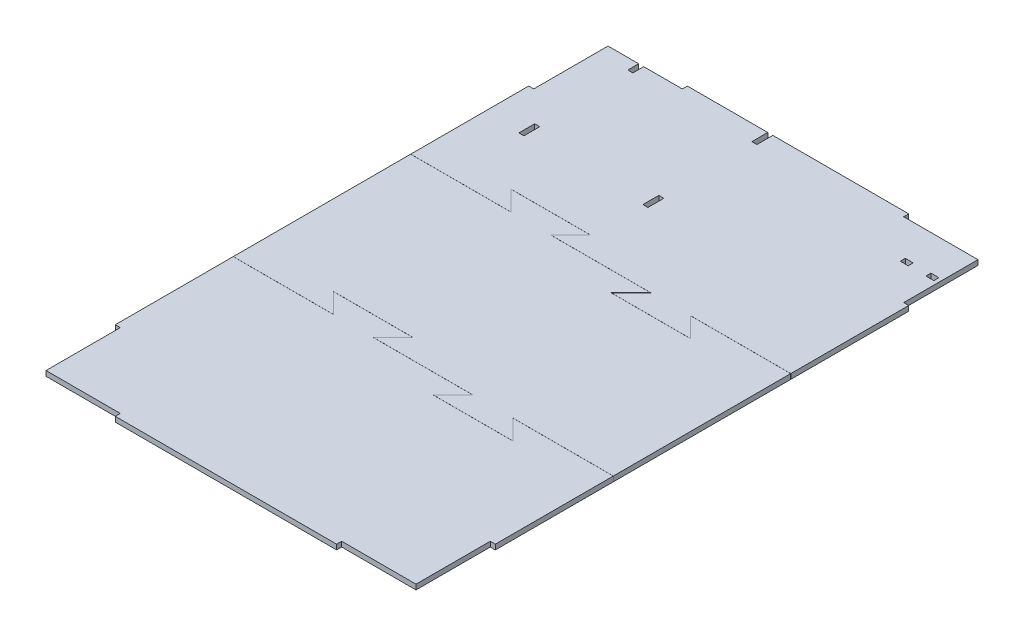
from build123d import *

# Parameters (mm, degrees)
SKETCH1_W           = 479
SKETCH1_H           = 721
BOSS_EXTRUDE1_DEPTH = 3.175
CUT_EXTRUDE1_DEPTH  = 433.851963724
SKETCH3_W           = 6.35
SKETCH3_H           = 20
SKETCH3_W_2         = 10
SKETCH3_H_2         = 6.35
CUT_EXTRUDE2_DEPTH  = 433.851963724
CUT_EXTRUDE3_DEPTH  = 433.851963724


with BuildPart() as part:
    # Sketch1 → Boss-Extrude1 (new, symmetric)
    with BuildSketch(Plane(origin=(0, 0, 0), x_dir=(1, 0, 0), z_dir=(0, 1, 0))):
        Rectangle(SKETCH1_W, SKETCH1_H)
    extrude(amount=BOSS_EXTRUDE1_DEPTH, both=True)

    # Sketch2 → Cut-Extrude1 (cut, through all)
    with BuildSketch(Plane(origin=(0, 3.175, 0), x_dir=(1, 0, 0), z_dir=(0, 1, 0))):
        Polygon((-239.5, 360.5), (-239.5, 260.5), (-233.15, 260.5), (-233.15, 354.15), (-139.5, 354.15), (-139.5, 360.5), align=None)
        Polygon((239.5, 360.5), (139.5, 360.5), (139.5, 354.15), (233.15, 354.15), (233.15, 260.5), (239.5, 260.5), align=None)
        Polygon((239.5, -360.5), (239.5, -260.5), (233.15, -260.5), (233.15, -354.15), (139.5, -354.15), (139.5, -360.5), align=None)
        Polygon((-239.5, -360.5), (-139.5, -360.5), (-139.5, -354.15), (-233.15, -354.15), (-233.15, -260.5), (-239.5, -260.5), align=None)
    extrude(amount=-CUT_EXTRUDE1_DEPTH, mode=Mode.SUBTRACT)

    # Sketch3 → Cut-Extrude2 (cut, through all)
    with BuildSketch(Plane.XZ.offset(3.175)):
        with Locations((-34.975, -350.5)):
            Rectangle(SKETCH3_W, SKETCH3_H)
        with Locations((190.85, -306.625)):
            Rectangle(SKETCH3_W_2, SKETCH3_H_2)
        with Locations((223.15, -306.625)):
            Rectangle(SKETCH3_W_2, SKETCH3_H_2)
        with Locations((-191.325, -350.5)):
            Rectangle(SKETCH3_W, SKETCH3_H)
        with Locations((-34.975, -213.15)):
            Rectangle(SKETCH3_W, SKETCH3_H)
        with Locations((-191.325, -213.15)):
            Rectangle(SKETCH3_W, SKETCH3_H)
    extrude(amount=-CUT_EXTRUDE2_DEPTH, mode=Mode.SUBTRACT)

    # Sketch4 → Cut-Extrude3 (cut, through all)
    with BuildSketch(Plane(origin=(0, 3.175, 0), x_dir=(1, 0, 0), z_dir=(0, 1, 0))):
        Polygon((-239.5, -111.766666667), (-113.166666667, -111.766666667), (-138.166666667, -86.766666667), (-38.166666667, -86.766666667), (-63.166666667, -111.766666667), (63.166666667, -111.766666667), (38.166666667, -136.766666667), (138.166666667, -136.766666667), (113.166666667, -111.766666667), (239.5, -111.766666667), (239.5, -111.866666667), (113.408088023, -111.866666667), (138.408088023, -136.866666667), (37.92524531, -136.866666667), (62.92524531, -111.866666667), (-63.408088023, -111.866666667), (-38.408088023, -86.866666667), (-137.92524531, -86.866666667), (-112.92524531, -111.866666667), (-239.5, -111.866666667), align=None)
        Polygon((-239.5, 111.866666667), (-113.166666667, 111.866666667), (-138.166666667, 136.866666667), (-38.166666667, 136.866666667), (-63.166666667, 111.866666667), (63.166666667, 111.866666667), (38.166666667, 86.866666667), (138.166666667, 86.866666667), (113.166666667, 111.866666667), (239.5, 111.866666667), (239.5, 111.766666667), (113.408088023, 111.766666667), (138.408088023, 86.766666667), (37.92524531, 86.766666667), (62.92524531, 111.766666667), (-63.408088023, 111.766666667), (-38.408088023, 136.766666667), (-137.92524531, 136.766666667), (-112.92524531, 111.766666667), (-239.5, 111.766666667), align=None)
    extrude(amount=-CUT_EXTRUDE3_DEPTH, mode=Mode.SUBTRACT)


with BuildPart() as cut_extrude3_piece_1:
    # of the separate pieces the step leaves, piece 1, a body of its own (cut_extrude3_pieces)
    add(part.part.solids().sort_by_distance((-139.5, 3.175, 360.5))[0])


with BuildPart() as cut_extrude3_piece_2:
    # of the separate pieces the step leaves, piece 2, a body of its own (cut_extrude3_pieces)
    add(part.part.solids().sort_by_distance((-239.5, 3.175, -260.5))[0])


with BuildPart() as cut_extrude3_piece_3:
    # of the separate pieces the step leaves, piece 3, a body of its own (cut_extrude3_pieces)
    add(part.part.solids().sort_by_distance((-239.5, 3.175, -111.766666667))[0])


solid = Compound([cut_extrude3_piece_1.part, cut_extrude3_piece_2.part, cut_extrude3_piece_3.part])
